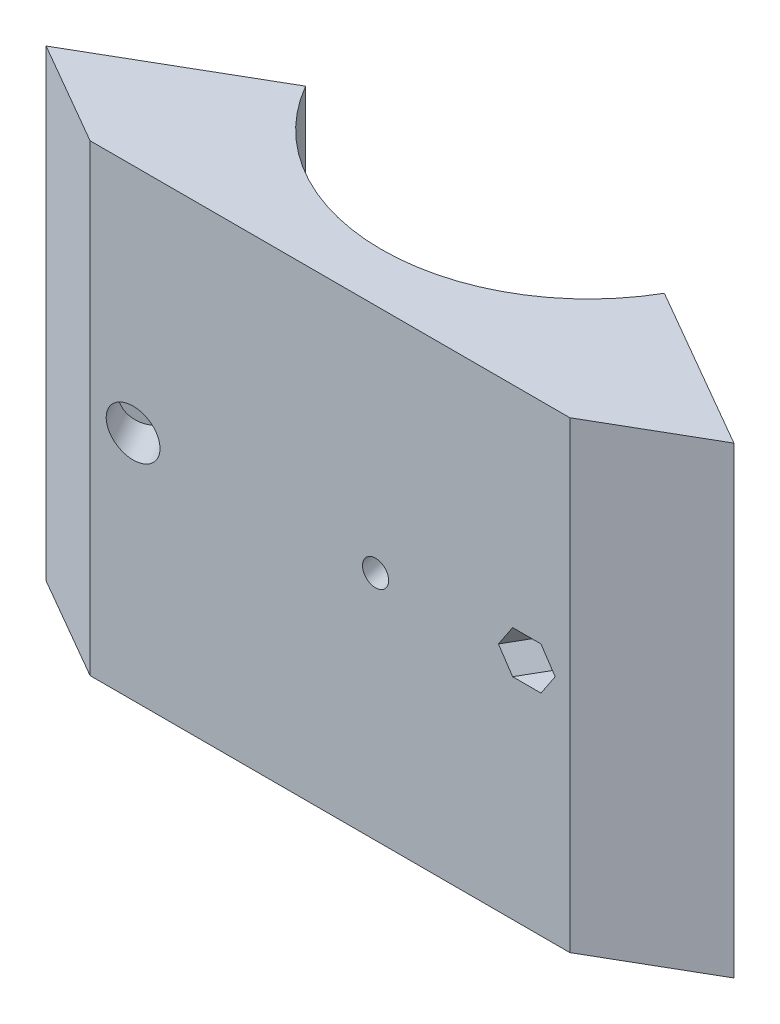
from build123d import *

# Parameters (mm, degrees)
BOSS_EXTRUDE1_DEPTH  = 57.15
CUT_EXTRUDE1_START   = -16.000000004
SKETCH3_R            = 3.499999985
CUT_EXTRUDE1_DEPTH   = 105.568182472
CUT_SWEEP1_PROFILE_R = 1.3462
CUT_SWEEP2_START     = 54.2798
CUT_SWEEP2_OUTLINE_R = 3.175
CUT_SWEEP2_DEPTH     = 11.070212874


# Read off the part's stored shape, not the designer's step: Cut-Sweep2
with BuildPart() as part:
    # Sketch1 → Boss-Extrude1 (new, symmetric)
    with BuildSketch(Plane(origin=(0, 0, 0), x_dir=(1, 0, 0), z_dir=(0, 1, 0))):
        with BuildLine():
            Line((-44.258055055, -25.5524), (-84.849935901, -48.988133333))
            Line((-84.849935901, -48.988133333), (-59.186716436, -63.8048))
            Line((-59.186716436, -63.8048), (0, -63.8048))
            Line((0, -63.8048), (0, -51.1048))
            ThreePointArc((0, -51.1048), (-25.5524, -44.258055055), (-44.258055055, -25.5524))
        make_face()
        with BuildLine():
            Line((0, -51.1048), (0, -63.8048))
            Line((0, -63.8048), (59.186716436, -63.8048))
            Line((59.186716436, -63.8048), (84.849935901, -48.988133333))
            Line((84.849935901, -48.988133333), (44.258055055, -25.5524))
            ThreePointArc((44.258055055, -25.5524), (25.5524, -44.258055055), (0, -51.1048))
        make_face()
    extrude(amount=BOSS_EXTRUDE1_DEPTH, both=True)

    # Sketch2 → Cut-Revolve7 (revolve, cut)
    with BuildSketch(Plane(origin=(0, 0, 0), x_dir=(1, 0, 0), z_dir=(0, 1, 0)), mode=Mode.PRIVATE) as cut_revolve7_sk:
        Polygon((-43.878504985, -64.929800036), (-44.528024059, -63.8048), (-48.569475926, -63.8048), (-47.770256416, -65.189088798), (-46.909593885, -66.679800029), align=None)
        Polygon((-48.569475926, -63.8048), (-44.528024059, -63.8048), (-51.024306947, -52.552907978), (-54.055395847, -54.30290797), align=None)
        Polygon((-54.055395847, -54.30290797), (-51.024306947, -52.552907978), (-61.024306886, -35.232400008), (-64.055395786, -36.9824), align=None)
    cut_revolve7 = revolve(cut_revolve7_sk.sketch.rotate(Axis((-64.055395786, 0, 36.9824), (0.4999999999999998, 0, 0.8660254037844388)), 180), axis=Axis((-64.055395786, 0, 36.9824), (0.4999999999999998, 0, 0.8660254037844388)), mode=Mode.SUBTRACT)

    # Sketch2<7> → Cut-Revolve8 (revolve, cut)
    with BuildSketch(Plane(origin=(0, 0, 0), x_dir=(1, 0, 0), z_dir=(0, 1, 0)), mode=Mode.PRIVATE) as cut_revolve8_sk:
        Polygon((-44.528024059, -63.8048), (-41.929947764, -63.8048), (-49.075749726, -51.427907942), (-51.024306947, -52.552907978), align=None)
    revolve(cut_revolve8_sk.sketch.rotate(Axis((-64.055395786, 0, 36.9824), (0.4999999999999998, 0, 0.8660254037844388)), 180), axis=Axis((-64.055395786, 0, 36.9824), (0.4999999999999998, 0, 0.8660254037844388)), mode=Mode.SUBTRACT)

    # Mirror1: Cut-Revolve7 across plane
    add(cut_revolve7.mirror(Plane(origin=(0, 0, 0), x_dir=(0, 0, 1), z_dir=(1, 0, 0))), mode=Mode.SUBTRACT)

    # Sketch3 → Cut-Extrude1 (cut, through all)
    with BuildSketch(Plane(origin=(0, 0, 0), x_dir=(-0.8660254037844386, 0, -0.5000000000000001), z_dir=(0.5000000000000001, 0, -0.8660254037844386)).offset(CUT_EXTRUDE1_START)):
        Polygon((-76.995888937, 5.250000041), (-80.026977874, 0), (-76.995888937, -5.250000041), (-70.933711063, -5.250000041), (-67.902622126, 0), (-70.933711063, 5.250000041), align=None)
        with Locations(Location((-73.9648, 0, 0), (0, 0, 180))):
            Circle(SKETCH3_R, mode=Mode.SUBTRACT)
    extrude(amount=-CUT_EXTRUDE1_DEPTH, mode=Mode.SUBTRACT)

    # Cut-Sweep1: sweep along a path in Sketch4
    with BuildLine(Plane(origin=(0, 0, 0), x_dir=(1, 0, 0), z_dir=(0, 1, 0))) as cut_sweep1_path:
        Line((0, 0), (9.429525456, -53.454473505))
    # Cut-Sweep1 profile (on start of the path) → Cut-Sweep1 (sweep, cut)
    with BuildSketch(Plane(origin=(0, 0, 0), x_dir=(0.984794960650155, 0, -0.17372071113733015), z_dir=(0.17372071113733015, 0, 0.984794960650155))):
        Circle(CUT_SWEEP1_PROFILE_R)
    sweep(path=cut_sweep1_path.line, mode=Mode.SUBTRACT)

    # Cut-Sweep2 outline → Cut-Sweep2 (cut)
    with BuildSketch(Plane(origin=(0, 0, 0), x_dir=(0.984794960650155, 0, -0.17372071113733004), z_dir=(0.17372071113733, 0, 0.984794960650155)).offset(CUT_SWEEP2_START)):
        Circle(CUT_SWEEP2_OUTLINE_R)
    extrude(amount=CUT_SWEEP2_DEPTH, mode=Mode.SUBTRACT)


solid = part.part
